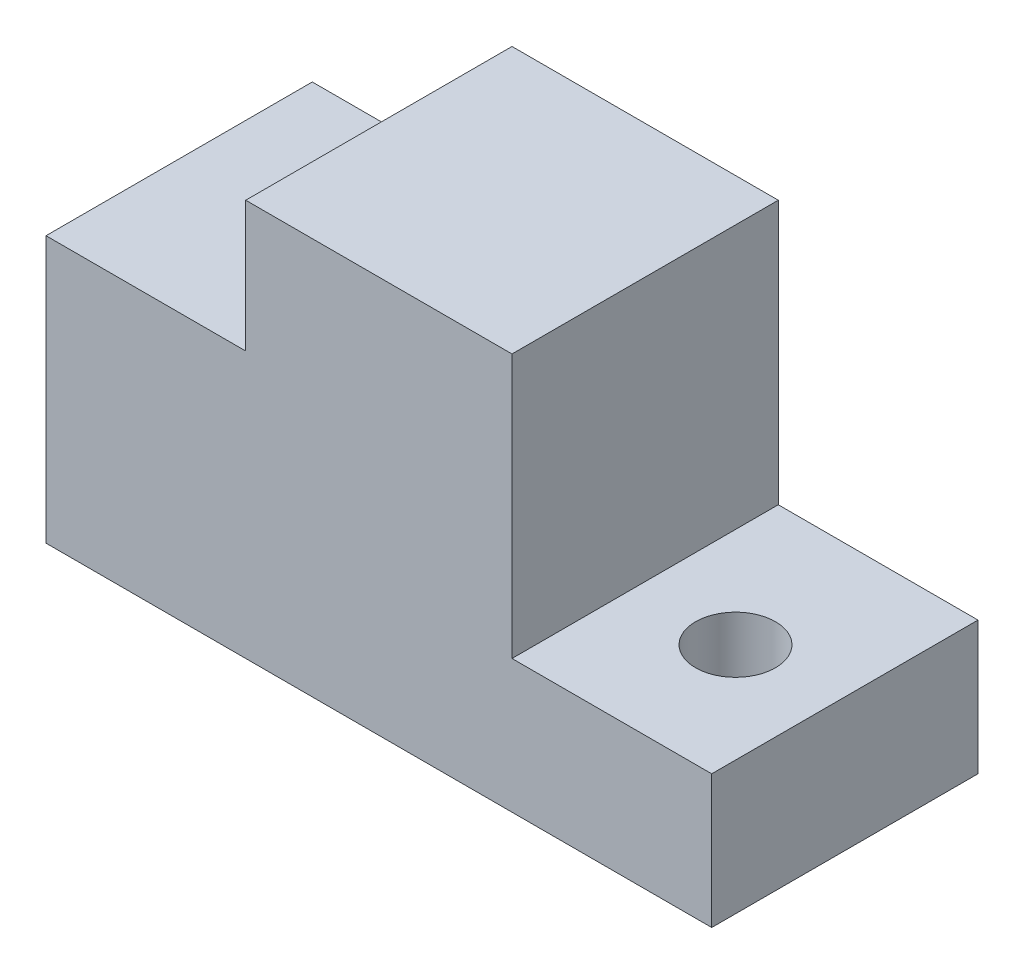
from build123d import *

# Parameters (mm, degrees)
RESSALTO_EXTRUS_O1_DEPTH = 20
ESBO_O2_R                = 3
CORTE_EXTRUS_O1_DEPTH    = 20


with BuildPart() as part:
    # Esboço1 → Ressalto-extrusão1 (new body)
    with BuildSketch(Plane.XY):
        Polygon((0, 0), (0, -20), (50, -20), (50, -10), (35, -10), (35, 9.809047503), (15, 9.809047503), (15, 0), align=None)
    extrude(amount=RESSALTO_EXTRUS_O1_DEPTH)

    # Esboço2 → Corte-extrusão1 (cut)
    with BuildSketch(Plane(origin=(0, -10, 0), x_dir=(1, 0, 0), z_dir=(0, 1, 0))):
        with Locations((42.5, -10.712031014)):
            Circle(ESBO_O2_R)
    extrude(amount=-CORTE_EXTRUS_O1_DEPTH, mode=Mode.SUBTRACT)


solid = part.part
